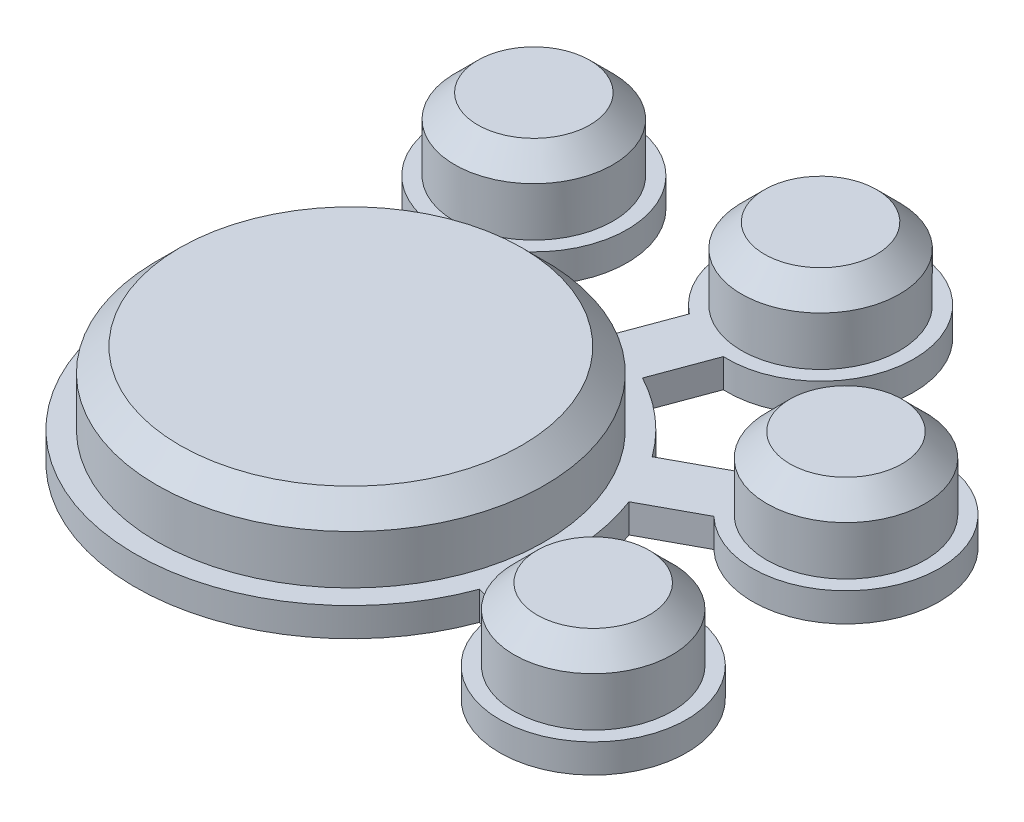
from build123d import *

# Parameters (mm, degrees)
EXTRUDE_1_DEPTH = 1
SKETCH_2_R      = 6.75
SKETCH_2_R_2    = 2.75
EXTRUDE_2_DEPTH = 2.5
CHAMFER_1_SIZE  = 0.8
SKETCH_3_R      = 1
EXTRUDE_3_DEPTH = 0.55


with BuildPart() as part:
    # 草图1 → 凸台-拉伸1 (new body)
    with BuildSketch(Plane(origin=(0, 0, 0), x_dir=(1, 0, 0), z_dir=(0, 1, 0))):
        with BuildLine():
            Line((7.043551493, -2.576505845), (8.076059132, -2.840709353))
            ThreePointArc((8.076059132, -2.840709353), (14.474108249, -3.703711259), (8.447906292, -1.387530186))
            Line((8.447906292, -1.387530186), (7.415398652, -1.123326679))
            ThreePointArc((7.415398652, -1.123326679), (7.457801324, 0.794480596), (7.012326866, 2.660314252))
            Line((7.012326866, 2.660314252), (8.926399669, 3.696883819))
            ThreePointArc((8.926399669, 3.696883819), (14.027222017, 7.596467297), (7.973989566, 5.455552349))
            Line((7.973989566, 5.455552349), (6.059916763, 4.418982782))
            ThreePointArc((6.059916763, 4.418982782), (4.915090766, 5.664969793), (3.520087943, 6.622611333))
            Line((3.520087943, 6.622611333), (4.279464541, 8.672225305))
            ThreePointArc((4.279464541, 8.672225305), (5.545200768, 14.966909707), (2.404044607, 9.367063468))
            Line((2.404044607, 9.367063468), (1.64466801, 7.317449497))
            ThreePointArc((1.64466801, 7.317449497), (-0.26194341, 7.495424314), (-2.151479183, 7.184785127))
            Line((-2.151479183, 7.184785127), (-2.56652322, 8.191285477))
            ThreePointArc((-2.56652322, 8.191285477), (-5.704393908, 13.833410284), (-3.953247825, 7.619450823))
            Line((-3.953247825, 7.619450823), (-3.538203787, 6.612950473))
            ThreePointArc((-3.538203787, 6.612950473), (-4.917661283, -5.662738517), (7.043551493, -2.576505845))
        make_face()
    extrude(amount=EXTRUDE_1_DEPTH)

    # 草图2 → 凸台-拉伸2 (add)
    with BuildSketch(Plane(origin=(0, 1, 0), x_dir=(1, 0, 0), z_dir=(0, 1, 0))):
        Circle(SKETCH_2_R)
        with Locations((-4.465418824, 10.828840308)):
            Circle(SKETCH_2_R_2)
        with Locations((4.416088752, 11.919352316)):
            Circle(SKETCH_2_R_2)
        with Locations((11.169385657, 6.048800879)):
            Circle(SKETCH_2_R_2)
        with Locations((11.325553388, -2.898042413)):
            Circle(SKETCH_2_R_2)
    extrude(amount=EXTRUDE_2_DEPTH)

    # 倒角1
    chamfer_1_edges = [part.edges().sort_by_distance(p)[0] for p in [
        (-6.75, 3.5, 0),
        (8.575553388, 3.5, 2.898042413),
        (8.419385657, 3.5, -6.048800879),
        (1.666088752, 3.5, -11.919352316),
        (-7.215418824, 3.5, -10.828840308),
    ]]
    chamfer(chamfer_1_edges, length=CHAMFER_1_SIZE)

    # 草图3 → 凸台-拉伸3 (add)
    with BuildSketch(Plane.XZ):
        Circle(SKETCH_3_R)
        with Locations((11.325553388, 2.898042413)):
            Circle(SKETCH_3_R)
        with Locations((11.169385657, -6.048800879)):
            Circle(SKETCH_3_R)
        with Locations((4.416088752, -11.919352316)):
            Circle(SKETCH_3_R)
        with Locations((-4.465418824, -10.828840308)):
            Circle(SKETCH_3_R)
    extrude(amount=EXTRUDE_3_DEPTH)


solid = part.part
